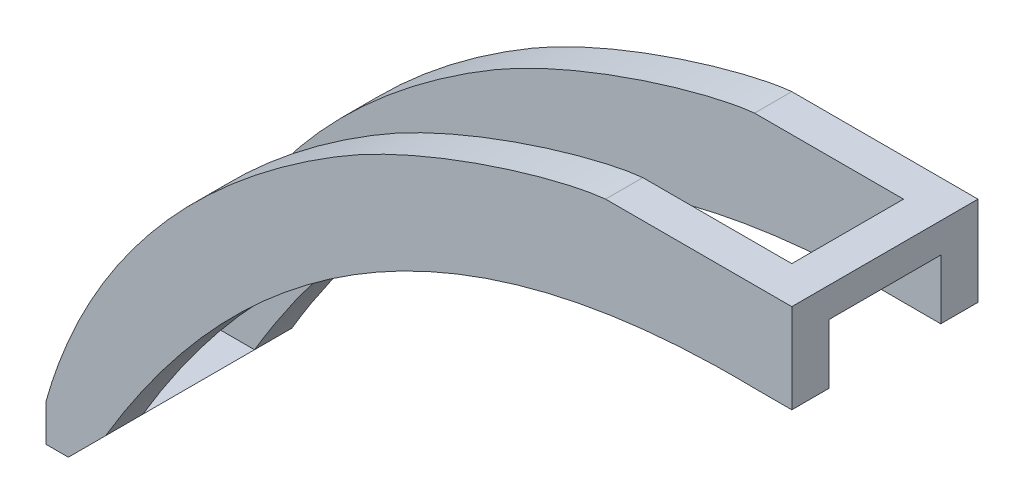
from build123d import *

# Parameters (mm, degrees)
Y_KSEKLIK_EKSTR_ZYON1_DEPTH = 5
IZIM2_W                     = 25
IZIM2_H                     = 12
Y_KSEKLIK_EKSTR_ZYON2_DEPTH = 5
Y_KSEKLIK_EKSTR_ZYON3_DEPTH = 5
IZIM4_W                     = 8.00000005
IZIM4_H                     = 25
Y_KSEKLIK_EKSTR_ZYON4_DEPTH = 5
PAH1_SIZE                   = 5
KES_EKSTR_ZYON1_REACH       = 118.474
IZIM5_W                     = 15
IZIM5_H                     = 11.42641292


with BuildPart() as part:
    # Çizim1 → Yükseklik-Ekstrüzyon1 (new body)
    with BuildSketch(Plane.XY):
        with BuildLine():
            Line((11.795489464, 52.159673173), (11.795489464, 59.159673173))
            Line((11.795489464, 59.159673173), (11.795489464, 64.159673173))
            Line((11.795489464, 64.159673173), (-8.204510536, 64.159673173))
            add(Edge.make_bspline(
                [(-8.204510536, 64.159673173), (-13.650800552, 63.66245189), (-29.933617008, 59.069334228), (-50.967122345, 47.507508093), (-76.199679343, 28.532057851), (-83.334078998, 3.083830852)],
                knots=[0.168211621, 0.168211621, 0.168211621, 0.168211621, 0.59733857, 0.680517408, 1, 1, 1, 1], degree=3))
            Line((-83.334078998, 3.083830852), (-75.334078998, 3.083830852))
            add(Edge.make_bspline(
                [(11.795489464, 52.159673173), (-45.452144083, 53.352401488), (-75.334078998, 3.083830852)],
                knots=[0, 0, 0, 1, 1, 1], degree=2))
        make_face()
    extrude(amount=Y_KSEKLIK_EKSTR_ZYON1_DEPTH)

    # Çizim2 → Yükseklik-Ekstrüzyon2 (add)
    with BuildSketch(Plane(origin=(11.795489464, 0, 0), x_dir=(0, 0, -1), z_dir=(1, 0, 0))):
        with Locations((7.5, 58.159673173)):
            Rectangle(IZIM2_W, IZIM2_H)
    extrude(amount=Y_KSEKLIK_EKSTR_ZYON2_DEPTH)

    # Çizim3 → Yükseklik-Ekstrüzyon3 (add)
    with BuildSketch(Plane(origin=(0, 0, -20), x_dir=(-1, 0, 0), z_dir=(0, 0, -1))):
        with BuildLine():
            Line((75.334078948, 3.083830937), (83.334078998, 3.083830852))
            add(Edge.make_bspline(
                [(83.334078998, 3.083830852), (76.199679343, 28.532057851), (50.967122345, 47.507508093), (29.933617008, 59.069334228), (13.650800552, 63.66245189), (8.204510536, 64.159673173)],
                knots=[0.168211621, 0.168211621, 0.168211621, 0.168211621, 0.487694213, 0.570873051, 1, 1, 1, 1], degree=3))
            Line((8.204510536, 64.159673173), (-11.795489464, 64.159673173))
            Line((-11.795489464, 64.159673173), (-11.795489464, 52.159673173))
            add(Edge.make_bspline(
                [(-11.795489464, 52.159673173), (45.452144035, 53.352401487), (75.334078948, 3.083830937)],
                knots=[0, 0, 0, 1, 1, 1], degree=2))
        make_face()
    extrude(amount=-Y_KSEKLIK_EKSTR_ZYON3_DEPTH)

    # Çizim4 → Yükseklik-Ekstrüzyon4 (add)
    with BuildSketch(Plane(origin=(-3.3e-08, 3.08383174, 0), x_dir=(1.0, 1.0658518704879855e-08, 0), z_dir=(1.0658518704879855e-08, -1.0, 0))):
        with Locations((-79.33407894, -7.5)):
            Rectangle(IZIM4_W, IZIM4_H)
    extrude(amount=Y_KSEKLIK_EKSTR_ZYON4_DEPTH)

    # Pah1
    pah1_edges = [part.edges().sort_by_distance(p)[0] for p in [
        (-75.334078894, -1.916169063, -7.5),
    ]]
    chamfer(pah1_edges, length=PAH1_SIZE - 0.0001)  # a hair under: the kernel refuses the full size

    # Çizim5 → Kes-Ekstrüzyon1 (cut, up to next)
    with BuildSketch(Plane.ZY.offset(-11.795489464), mode=Mode.PRIVATE) as kes_ekstr_zyon1_sk1:
        with Locations((-7.5, 54.446466713)):
            Rectangle(IZIM5_W, IZIM5_H)
    kes_ekstr_zyon1_tool1 = extrude(kes_ekstr_zyon1_sk1.sketch, amount=-KES_EKSTR_ZYON1_REACH, mode=Mode.PRIVATE) & part.part
    add(kes_ekstr_zyon1_tool1.solids().sort_by_distance((11.795489, 54.446467, -7.5))[0], mode=Mode.SUBTRACT)


solid = part.part
